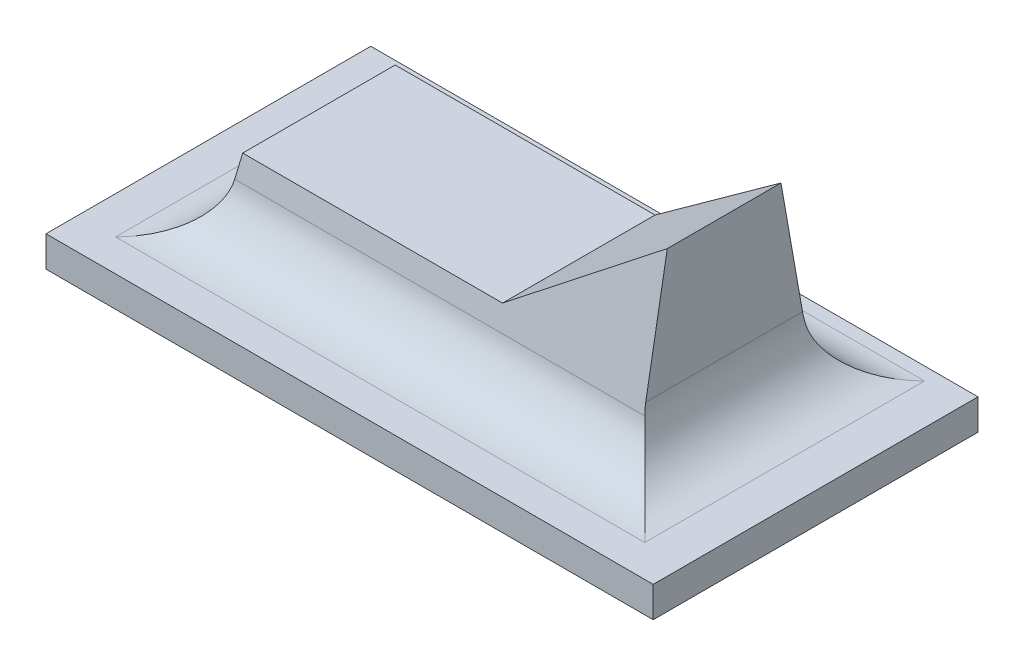
from build123d import *

# Parameters (mm, degrees)
SKETCH1_W             = 30.1
SKETCH1_H             = 1.52
BOSS_EXTRUDE1_DEPTH   = 16.1
BOSS_EXTRUDE2_START   = 3.6
SKETCH2_W             = 12.88
SKETCH2_H             = 7.56
BOSS_EXTRUDE2_DEPTH   = 3.68
BOSS_EXTRUDE2_DRAFT   = 10
BOSS_EXTRUDE3_START   = -11.337254685
BOSS_EXTRUDE3_DEPTH   = 5.63450937
BOSS_EXTRUDE3_START_2 = 17.89
BOSS_EXTRUDE3_2_DEPTH = 7.204859471
BOSS_EXTRUDE3_START_3 = 1
BOSS_EXTRUDE3_3_DEPTH = 5.72461499
FILLET1_R             = 3


with BuildPart() as part:
    # Sketch1 → Boss-Extrude1 (new body)
    with BuildSketch(Plane.XY):
        with Locations((15.05, 0.76)):
            Rectangle(SKETCH1_W, SKETCH1_H)
    extrude(amount=-BOSS_EXTRUDE1_DEPTH)


with BuildPart() as boss_extrude2_tool:
    # Sketch2 → Boss-Extrude2 (with draft: the straight prism first)
    with BuildSketch(Plane(origin=(0, 1.52, 0), x_dir=(1, 0, 0), z_dir=(0, 1, 0)).offset(BOSS_EXTRUDE2_START)):
        with Locations((11.45, 8.52)):
            Rectangle(SKETCH2_W, SKETCH2_H)
    extrude(amount=-BOSS_EXTRUDE2_DEPTH)
    # Boss-Extrude2: the draft: its side faces are tilted about the plane it starts from
    boss_extrude2_sides = [boss_extrude2_tool.faces().sort_by_distance(p)[0] for p in [
        (5.01, 3.28, -8.52),
        (11.45, 3.28, -4.74),
        (17.89, 3.28, -8.52),
        (11.45, 3.28, -12.3),
    ]]
    draft(boss_extrude2_sides, Plane(origin=(0, 1.52, 0), x_dir=(1, 0, 0), z_dir=(0, 1, 0)).offset(BOSS_EXTRUDE2_START), BOSS_EXTRUDE2_DRAFT)


with BuildPart() as part_1:
    add(part.part)

    # Boss-Extrude2: add boss_extrude2_tool
    add(boss_extrude2_tool.part)

    # Boss-Extrude3: read off the stored shape, not the designer's step
    # Boss-Extrude3 outline → Boss-Extrude3 (add)
    with BuildSketch(Plane.XY.offset(BOSS_EXTRUDE3_START)):
        Polygon((18.524777131, 1.52), (25.094859471, 1.52), (25.094859471, 10.58), (17.89, 5.12), align=None)
    extrude(amount=BOSS_EXTRUDE3_DEPTH)

    # Boss-Extrude3 2 outline → Boss-Extrude3 2 (add)
    with BuildSketch(Plane.YZ.offset(BOSS_EXTRUDE3_START_2)):
        Polygon((1.52, -11.337254685), (1.52, -12.934777131), (10.58, -11.337254685), align=None)
        Polygon((1.52, -4.105222869), (1.52, -5.702745315), (10.58, -5.702745315), align=None)
    extrude(amount=BOSS_EXTRUDE3_2_DEPTH)

    # Boss-Extrude3 3 outline → Boss-Extrude3 3 (cut)
    with BuildSketch(Plane(origin=(0, 0, 0), x_dir=(0.7969977291170371, 0.6039823008849562, 0), z_dir=(0.6039823008849562, -0.7969977291170373, 0)).offset(BOSS_EXTRUDE3_START_3)):
        Polygon((26.390678754, -11.337254685), (26.390678754, -5.702745315), (17.350678754, -4.74), (17.350678754, -12.3), align=None)
    extrude(amount=BOSS_EXTRUDE3_3_DEPTH, mode=Mode.SUBTRACT)

    # Fillet1
    fillet1_edges = [part_1.edges().sort_by_distance(p)[0] for p in [
        (11.45, 1.52, -4.105222869),
        (11.45, 1.52, -12.934777131),
        (4.375222869, 1.52, -8.52),
        (25.094859471, 1.52, -8.52),
    ]]
    fillet(fillet1_edges, radius=FILLET1_R)


solid = part_1.part
